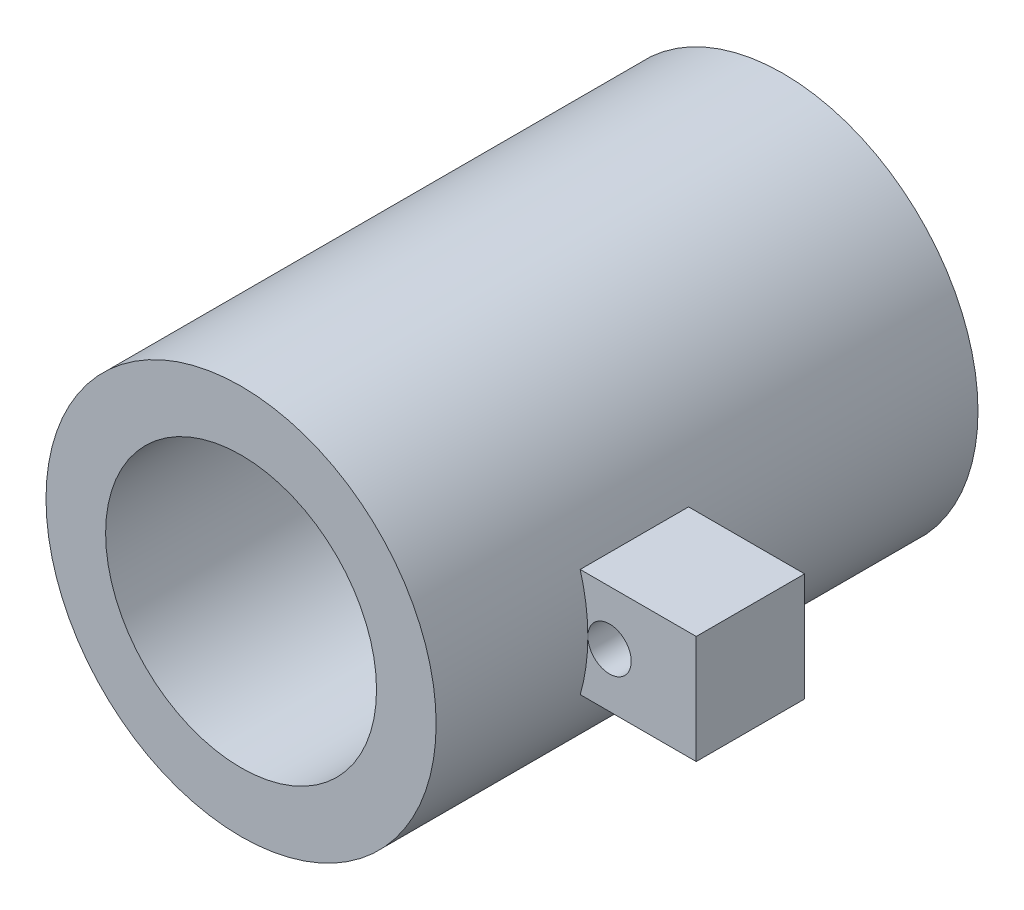
from build123d import *

# Parameters (mm, degrees)
SKIZZE1_R                       = 9
SKIZZE1_R_2                     = 6.25
AUFSATZ_LINEAR_AUSTRAGEN1_DEPTH = 12.5
AUFSATZ_LINEAR_START            = 8
SKIZZE2_W                       = 5
SKIZZE2_H                       = 5
AUFSATZ_LINEAR_AUSTRAGEN2_DEPTH = 6
SKIZZE3_R                       = 1
SCHNITT_LINEAR_AUSTRAGEN1_DEPTH = 8


with BuildPart() as part:
    # Skizze1 → Aufsatz-Linear austragen1 (new, symmetric)
    with BuildSketch(Plane.XY):
        Circle(SKIZZE1_R)
        Circle(SKIZZE1_R_2, mode=Mode.SUBTRACT)
    extrude(amount=AUFSATZ_LINEAR_AUSTRAGEN1_DEPTH, both=True)

    # Skizze2 → Aufsatz-Linear austragen2 (add)
    with BuildSketch(Plane(origin=(0, 0, 0), x_dir=(0, 0, -1), z_dir=(1, 0, 0)).offset(AUFSATZ_LINEAR_START)):
        with Locations((-3, 0)):
            Rectangle(SKIZZE2_W, SKIZZE2_H)
    extrude(amount=AUFSATZ_LINEAR_AUSTRAGEN2_DEPTH)

    # Skizze3 → Schnitt-Linear austragen1 (cut)
    with BuildSketch(Plane.XY.offset(5.5)):
        with Locations((10, 0)):
            Circle(SKIZZE3_R)
    extrude(amount=-SCHNITT_LINEAR_AUSTRAGEN1_DEPTH, mode=Mode.SUBTRACT)


solid = part.part
